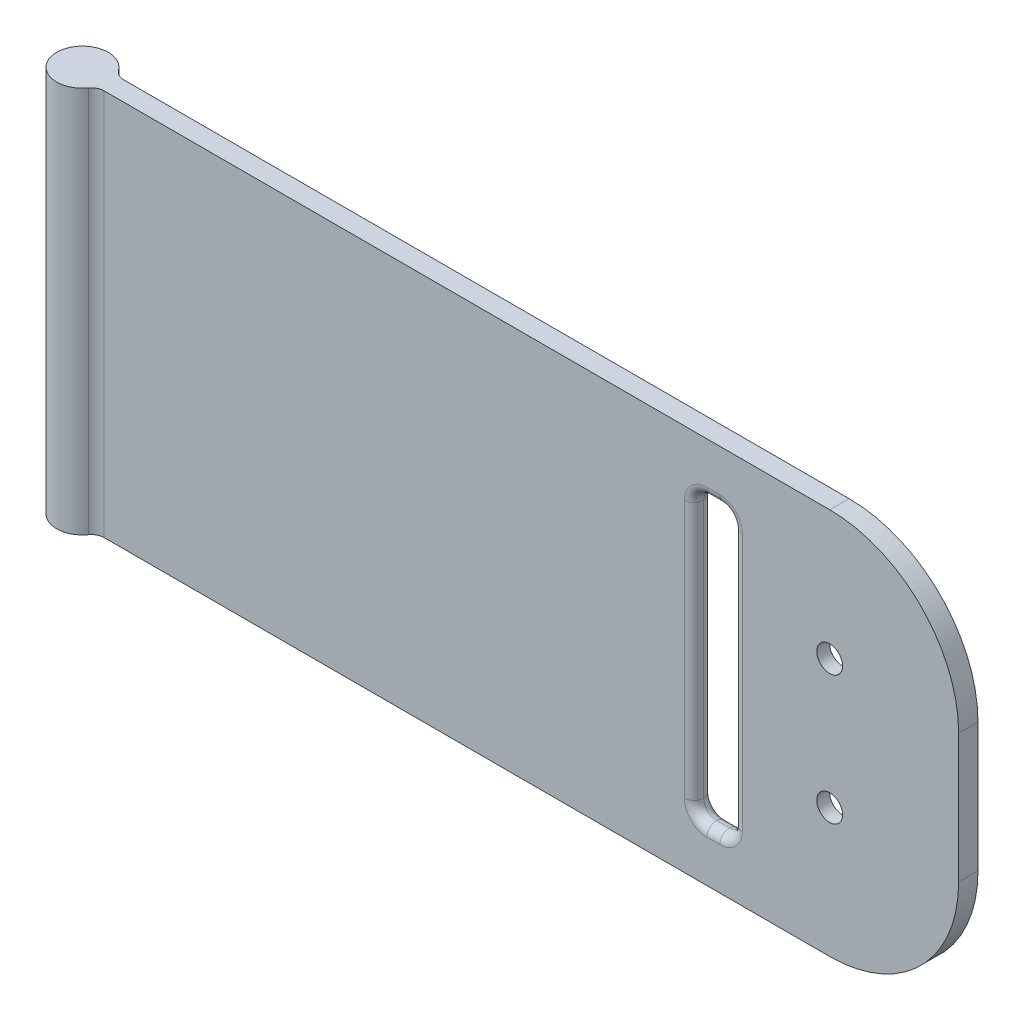
from build123d import *

# Parameters (mm, degrees)
BOSS_EXTRUDE1_DEPTH = 30
SKETCH2_W           = 3
SKETCH2_H           = 22
CUT_EXTRUDE1_DEPTH  = 75.999903187
FILLET2_R           = 10
SKETCH5_R           = 2
CUT_EXTRUDE2_DEPTH  = 0.5
SKETCH8_R           = 1
CUT_EXTRUDE3_DEPTH  = 75.983234646
FILLET3_R           = 1
FILLET4_R           = 0.75


with BuildPart() as part:
    # Sketch1 → Boss-Extrude1 (new body)
    with BuildSketch(Plane(origin=(0, 0, 0), x_dir=(1, 0, 0), z_dir=(0, 1, 0))):
        with BuildLine():
            Line((2.436698586, 0.75), (68.683498586, 0.75))
            Line((68.683498586, 0.75), (68.683498586, -0.75))
            Line((68.683498586, -0.75), (2.436698586, -0.75))
            ThreePointArc((2.436698586, -0.75), (1.980263122, -0.860243479), (1.624465724, -1.166666667))
            ThreePointArc((1.624465724, -1.166666667), (-2, 0), (1.624465724, 1.166666667))
            ThreePointArc((1.624465724, 1.166666667), (1.980263122, 0.860243479), (2.436698586, 0.75))
        make_face()
    extrude(amount=BOSS_EXTRUDE1_DEPTH)

    # Sketch2 → Cut-Extrude1 (cut, through all)
    with BuildSketch(Plane.XY.offset(0.75)):
        with Locations((49.664488586, 15)):
            Rectangle(SKETCH2_W, SKETCH2_H)
    extrude(amount=-CUT_EXTRUDE1_DEPTH, mode=Mode.SUBTRACT)

    # Fillet2
    fillet2_edges = [part.edges().sort_by_distance(p)[0] for p in [
        (68.683498586, 30, 0),
        (68.683498586, 0, 0),
    ]]
    fillet(fillet2_edges, radius=FILLET2_R)

    # Sketch5 → Cut-Extrude2 (cut)
    with BuildSketch(Plane(origin=(0, 0, -0.75), x_dir=(-1, 0, 0), z_dir=(0, 0, -1))):
        with Locations((-58.683498586, 20)):
            Circle(SKETCH5_R)
        with Locations((-58.683498586, 10)):
            Circle(SKETCH5_R)
    extrude(amount=-CUT_EXTRUDE2_DEPTH, mode=Mode.SUBTRACT)

    # Sketch8 → Cut-Extrude3 (cut, through all)
    with BuildSketch(Plane(origin=(0, 0, -0.25), x_dir=(-1, 0, 0), z_dir=(0, 0, -1))):
        with Locations((-58.683498586, 20)):
            Circle(SKETCH8_R)
        with Locations((-58.683498586, 10)):
            Circle(SKETCH8_R)
    extrude(amount=-CUT_EXTRUDE3_DEPTH, mode=Mode.SUBTRACT)

    # Fillet3
    fillet3_edges = [part.edges().sort_by_distance(p)[0] for p in [
        (51.164488586, 26, 0),
        (51.164488586, 4, 0),
        (48.164488586, 4, 0),
        (48.164488586, 26, 0),
    ]]
    fillet(fillet3_edges, radius=FILLET3_R)

    # Fillet4
    fillet4_edges = [part.edges().sort_by_distance(p)[0] for p in [
        (48.457381805, 25.707106781, 0.75),
        (49.664488586, 26, 0.75),
        (50.871595367, 25.707106781, 0.75),
        (51.164488586, 15, 0.75),
        (50.871595367, 4.292893219, 0.75),
        (49.664488586, 4, 0.75),
        (48.457381805, 4.292893219, 0.75),
        (48.457381805, 25.707106781, -0.75),
        (49.664488586, 26, -0.75),
        (50.871595367, 25.707106781, -0.75),
        (51.164488586, 15, -0.75),
        (50.871595367, 4.292893219, -0.75),
        (49.664488586, 4, -0.75),
        (48.457381805, 4.292893219, -0.75),
        (48.164488586, 15, 0.75),
        (48.164488586, 15, -0.75),
    ]]
    fillet(fillet4_edges, radius=FILLET4_R - 0.0001)  # a hair under: the kernel refuses the full size


solid = part.part
